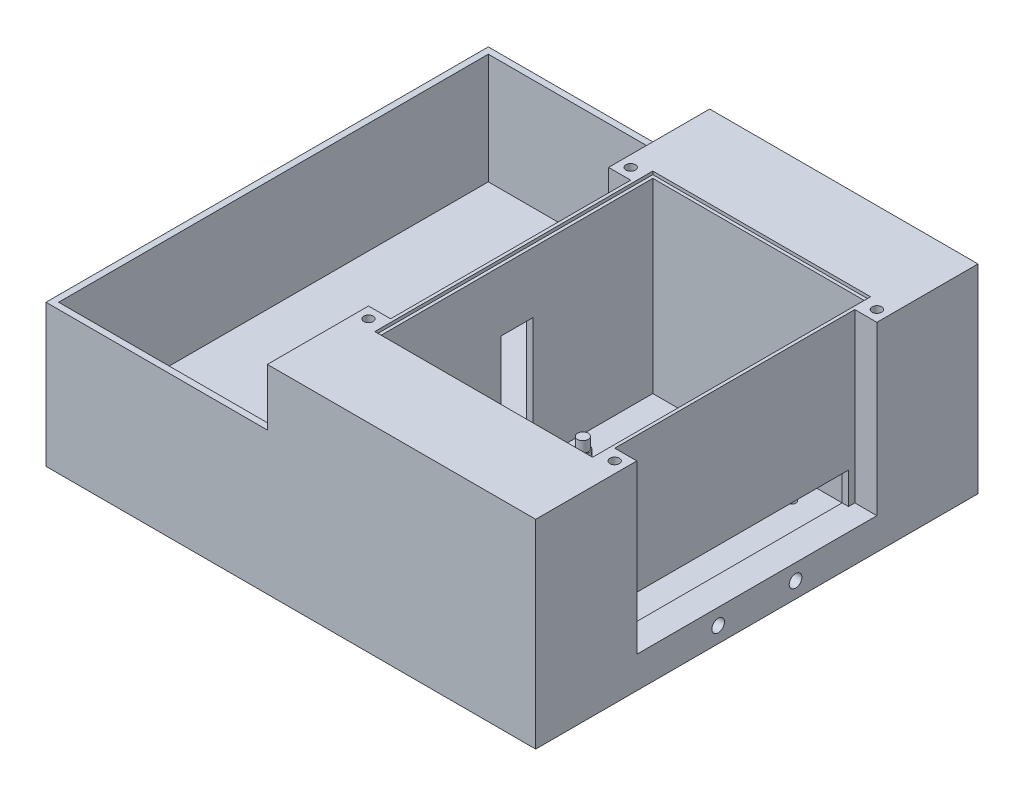
from build123d import *

# Parameters (mm, degrees)
SKETCH_1_W           = 155
SKETCH_1_H           = 90
EXTRUDE_2_DEPTH      = 10
CUT_EXTRUDE_1_DEPTH  = 7
SKETCH_3_R           = 2
EXTRUDE_3_DEPTH      = 2
SKETCH_4_R           = 1.7
EXTRUDE_4_DEPTH      = 3.4
EXTRUDE_5_DEPTH      = 14
SKETCH_6_W           = 7
SKETCH_6_H           = 7
EXTRUDE_6_DEPTH      = 14
SKETCH_16_W          = 68.929560361
SKETCH_16_H          = 88
CUT_EXTRUDE_3_DEPTH  = 1
SKETCH_17_R          = 1.5
CUT_EXTRUDE_4_DEPTH  = 5
SKETCH_18_R          = 2
CUT_EXTRUDE_5_DEPTH  = 18
CUT_EXTRUDE_START    = -17
SKETCH_20_R          = 2
CUT_EXTRUDE_8_DEPTH  = 17
SKETCH_21_W          = 7
SKETCH_21_H          = 7
SKETCH_21_R          = 1
EXTRUDE_7_DEPTH      = 90
SKETCH_22_W          = 86.23703967
SKETCH_22_H          = 80
CUT_EXTRUDE_11_DEPTH = 7
SKETCH_23_R          = 1
CUT_EXTRUDE_12_DEPTH = 90
SKETCH_25_W          = 2
SKETCH_25_H          = 7
EXTRUDE_8_DEPTH      = 10
SKETCH_26_W          = 72
SKETCH_26_H          = 10
CUT_EXTRUDE_13_DEPTH = 16
SKETCH_27_R          = 1
CUT_EXTRUDE_14_DEPTH = 7
CUT_EXTRUDE_START_2  = -7
SKETCH_28_R          = 1
CUT_EXTRUDE_15_DEPTH = 7
SKETCH_30_W          = 7
SKETCH_30_H          = 5
CUT_EXTRUDE_16_DEPTH = 7
SKETCH_32_W          = 90
SKETCH_32_H          = 10
CUT_EXTRUDE_17_DEPTH = 8
SKETCH_36_W          = 90
SKETCH_36_H          = 10
SKETCH_36_R          = 2
EXTRUDE_9_DEPTH      = 8
SKETCH_37_R          = 1
EXTRUDE_10_DEPTH     = 2
EXTRUDE_START        = -2
SKETCH_39_R          = 1
EXTRUDE_11_DEPTH     = 2
EXTRUDE_12_DEPTH     = 25
EXTRUDE_13_DEPTH     = 25
EXTRUDE_14_DEPTH     = 35
SKETCH_47_W          = 10
SKETCH_47_H          = 10.796424299
CUT_EXTRUDE_18_DEPTH = 4
EXTRUDE_START_2      = 39
SKETCH_51_R          = 1.5
SKETCH_51_W          = 68.929560361
SKETCH_51_H          = 88
EXTRUDE_15_DEPTH     = 39
SKETCH_52_W          = 68.929560361
SKETCH_52_H          = 88
SKETCH_52_W_2        = 66.929560361
SKETCH_52_H_2        = 86
EXTRUDE_16_DEPTH     = 39
SKETCH_56_W          = 10
SKETCH_56_H          = 22
CUT_EXTRUDE_19_DEPTH = 39
SKETCH_57_R          = 1.4
CUT_EXTRUDE_21_DEPTH = 39
SKETCH_58_R          = 1.4
EXTRUDE_17_DEPTH     = 5
SKETCH_59_W          = 7
SKETCH_59_H          = 76
CUT_EXTRUDE_22_DEPTH = 2


with BuildPart() as part:
    # Эскиз1 → Бобышка-Вытянуть2 (new body)
    with BuildSketch(Plane(origin=(0, 0, 0), x_dir=(1, 0, 0), z_dir=(0, 1, 0))):
        with Locations((-1.156716418, -16.830553117)):
            Rectangle(SKETCH_1_W, SKETCH_1_H)
    extrude(amount=EXTRUDE_2_DEPTH)

    # Эскиз2 → Вырез-Вытянуть1 (cut)
    with BuildSketch(Plane(origin=(0, 10, 0), x_dir=(1, 0, 0), z_dir=(0, 1, 0))):
        Polygon((57.343283582, 26.169446883), (57.343283582, 28.169446883), (49.343283582, 28.169446883), (49.343283582, 26.169446883), (-7.586276779, 26.169446883), (-7.586276779, -59.830553117), (49.343283582, -59.830553117), (49.343283582, -61.830553117), (57.343283582, -61.830553117), (57.343283582, -59.830553117), (59.343283582, -59.830553117), (59.343283582, 26.169446883), align=None)
    extrude(amount=-CUT_EXTRUDE_1_DEPTH, mode=Mode.SUBTRACT)

    # Эскиз3 → Бобышка-Вытянуть3 (add)
    with BuildSketch(Plane(origin=(0, 3, 0), x_dir=(1, 0, 0), z_dir=(0, 1, 0))):
        with Locations((-1.54062003, -2.021576512)):
            Circle(SKETCH_3_R)
        with Locations((-1.54062003, -22.021576512)):
            Circle(SKETCH_3_R)
        with Locations((26.45937997, -2.021576512)):
            Circle(SKETCH_3_R)
        with Locations((26.45937997, -22.021576512)):
            Circle(SKETCH_3_R)
    extrude(amount=EXTRUDE_3_DEPTH)

    # Эскиз4 → Бобышка-Вытянуть4 (add)
    with BuildSketch(Plane(origin=(0, 5, 0), x_dir=(1, 0, 0), z_dir=(0, 1, 0))):
        with Locations((-1.54062003, -2.021576512)):
            Circle(SKETCH_4_R)
        with Locations((-1.54062003, -22.021576512)):
            Circle(SKETCH_4_R)
        with Locations((26.45937997, -22.021576512)):
            Circle(SKETCH_4_R)
        with Locations((26.45937997, -2.021576512)):
            Circle(SKETCH_4_R)
    extrude(amount=EXTRUDE_4_DEPTH)

    # Эскиз5 → Бобышка-Вытянуть5 (add)
    with BuildSketch(Plane(origin=(0, 10, 0), x_dir=(1, 0, 0), z_dir=(0, 1, 0))):
        Polygon((-9.586276779, 28.169446883), (61.343283582, 28.169446883), (61.343283582, 26.169446883), (61.343283582, -61.830553117), (-9.586276779, -61.830553117), (-9.586276779, 26.169446883), align=None)
        Polygon((49.343283582, -59.830553117), (57.343283582, -59.830553117), (59.343283582, -59.830553117), (59.343283582, 26.169446883), (-7.586276779, 26.169446883), (-7.586276779, -59.830553117), align=None, mode=Mode.SUBTRACT)
    extrude(amount=EXTRUDE_5_DEPTH)

    # Эскиз6 → Бобышка-Вытянуть6 (add)
    with BuildSketch(Plane(origin=(0, 10, 0), x_dir=(1, 0, 0), z_dir=(0, 1, 0))):
        with Locations((64.843283582, 24.669446883)):
            Rectangle(SKETCH_6_W, SKETCH_6_H)
        with Locations((64.843283582, -58.330553117)):
            Rectangle(SKETCH_6_W, SKETCH_6_H)
        with Locations((-13.086276779, -58.330553117)):
            Rectangle(SKETCH_6_W, SKETCH_6_H)
        with Locations((-13.086276779, 24.669446883)):
            Rectangle(SKETCH_6_W, SKETCH_6_H)
    extrude(amount=EXTRUDE_6_DEPTH)

    # Эскиз16 → Вырез-Вытянуть3 (cut)
    with BuildSketch(Plane(origin=(0, 24, 0), x_dir=(1, 0, 0), z_dir=(0, 1, 0))):
        with Locations((25.878503402, -16.830553117)):
            Rectangle(SKETCH_16_W, SKETCH_16_H)
    extrude(amount=-CUT_EXTRUDE_3_DEPTH, mode=Mode.SUBTRACT)

    # Эскиз17 → Вырез-Вытянуть4 (cut)
    with BuildSketch(Plane(origin=(0, 24, 0), x_dir=(1, 0, 0), z_dir=(0, 1, 0))):
        with Locations((-13.086276779, 24.669446883)):
            Circle(SKETCH_17_R)
        with Locations((64.843283582, 24.669446883)):
            Circle(SKETCH_17_R)
        with Locations((-13.086276779, -58.330553117)):
            Circle(SKETCH_17_R)
        with Locations((64.843283582, -58.330553117)):
            Circle(SKETCH_17_R)
    extrude(amount=-CUT_EXTRUDE_4_DEPTH, mode=Mode.SUBTRACT)

    # Эскиз18 → Вырез-Вытянуть5 (cut)
    with BuildSketch(Plane(origin=(76.343283582, 0, 0), x_dir=(0, 0, -1), z_dir=(1, 0, 0))):
        with Locations((-29.080553117, 5)):
            Circle(SKETCH_18_R)
        with Locations((-4.580553117, 5)):
            Circle(SKETCH_18_R)
    extrude(amount=-CUT_EXTRUDE_5_DEPTH, mode=Mode.SUBTRACT)

    # Эскиз20 → Вырез-Вытянуть8 (cut)
    with BuildSketch(Plane.ZY.offset(78.656716418).offset(CUT_EXTRUDE_START)):
        with Locations((4.580553117, 5)):
            Circle(SKETCH_20_R)
        with Locations((29.080553117, 5)):
            Circle(SKETCH_20_R)
    extrude(amount=CUT_EXTRUDE_8_DEPTH, mode=Mode.SUBTRACT)

    # Эскиз21 → Бобышка-Вытянуть7 (add)
    # profile 1 of 2: a face of its own
    with BuildSketch(Plane.XY.offset(61.830553117)):
        with Locations((72.843283582, -3.5)):
            Rectangle(SKETCH_21_W, SKETCH_21_H)
    # profile 2 of 2: a face of its own
    with BuildSketch(Plane.XY.offset(61.830553117)):
        with Locations((1.843283582, -3.5)):
            Rectangle(SKETCH_21_W, SKETCH_21_H)
        with Locations((1.843283582, -3.5)):
            Circle(SKETCH_21_R, mode=Mode.SUBTRACT)
    extrude(amount=-EXTRUDE_7_DEPTH)

    # Эскиз22 → Вырез-Вытянуть11 (cut)
    with BuildSketch(Plane.XZ.offset(7)):
        with Locations((33.224763747, 16.830553117)):
            Rectangle(SKETCH_22_W, SKETCH_22_H)
    extrude(amount=-CUT_EXTRUDE_11_DEPTH, mode=Mode.SUBTRACT)

    # Эскиз23 → Вырез-Вытянуть12 (cut)
    with BuildSketch(Plane.XY.offset(61.830553117)):
        with Locations((72.843283582, -3.5)):
            Circle(SKETCH_23_R)
    extrude(amount=-CUT_EXTRUDE_12_DEPTH, mode=Mode.SUBTRACT)

    # Эскиз25 → Бобышка-Вытянуть8 (add)
    with BuildSketch(Plane(origin=(49.343283582, 0, 0), x_dir=(0, 0, -1), z_dir=(1, 0, 0))):
        with Locations((-60.830553117, 6.5)):
            Rectangle(SKETCH_25_W, SKETCH_25_H)
        with Locations((27.169446883, 6.5)):
            Rectangle(SKETCH_25_W, SKETCH_25_H)
    extrude(amount=EXTRUDE_8_DEPTH)

    # Эскиз26 → Вырез-Вытянуть13 (cut)
    with BuildSketch(Plane(origin=(61.343283582, 0, 0), x_dir=(0, 0, -1), z_dir=(1, 0, 0))):
        with Locations((-16.830553117, 15)):
            Rectangle(SKETCH_26_W, SKETCH_26_H)
    extrude(amount=-CUT_EXTRUDE_13_DEPTH, mode=Mode.SUBTRACT)

    # Эскиз27 → Вырез-Вытянуть14 (cut)
    with BuildSketch(Plane.XY.offset(61.830553117)):
        with Locations((1.843283582, 5)):
            Circle(SKETCH_27_R)
        with Locations((72.843283582, 5)):
            Circle(SKETCH_27_R)
    extrude(amount=-CUT_EXTRUDE_14_DEPTH, mode=Mode.SUBTRACT)

    # Эскиз28 → Вырез-Вытянуть15 (cut)
    with BuildSketch(Plane(origin=(0, 0, -28.169446883), x_dir=(-1, 0, 0), z_dir=(0, 0, -1)).offset(CUT_EXTRUDE_START_2)):
        with Locations((-72.843283582, 5)):
            Circle(SKETCH_28_R)
        with Locations((-1.843283582, 5)):
            Circle(SKETCH_28_R)
    extrude(amount=CUT_EXTRUDE_15_DEPTH, mode=Mode.SUBTRACT)

    # Эскиз30 → Вырез-Вытянуть16 (cut)
    with BuildSketch(Plane.XZ.offset(7)):
        with Locations((1.843283582, 59.330553117)):
            Rectangle(SKETCH_30_W, SKETCH_30_H)
        with Locations((72.843283582, 59.330553117)):
            Rectangle(SKETCH_30_W, SKETCH_30_H)
        with Locations((1.843283582, -25.669446883)):
            Rectangle(SKETCH_30_W, SKETCH_30_H)
        with Locations((72.843283582, -25.669446883)):
            Rectangle(SKETCH_30_W, SKETCH_30_H)
    extrude(amount=-CUT_EXTRUDE_16_DEPTH, mode=Mode.SUBTRACT)

    # Эскиз32 → Вырез-Вытянуть17 (cut)
    with BuildSketch(Plane(origin=(76.343283582, 0, 0), x_dir=(0, 0, -1), z_dir=(1, 0, 0))):
        with Locations((-16.830553117, 5)):
            Rectangle(SKETCH_32_W, SKETCH_32_H)
    extrude(amount=-CUT_EXTRUDE_17_DEPTH, mode=Mode.SUBTRACT)

    # Эскиз36 → Бобышка-Вытянуть9 (add)
    with BuildSketch(Plane.ZY.offset(78.656716418)):
        with Locations((16.830553117, 5)):
            Rectangle(SKETCH_36_W, SKETCH_36_H)
        with Locations((4.580553117, 5)):
            Circle(SKETCH_36_R, mode=Mode.SUBTRACT)
        with Locations((29.080553117, 5)):
            Circle(SKETCH_36_R, mode=Mode.SUBTRACT)
    extrude(amount=EXTRUDE_9_DEPTH)

    # Эскиз37 → Бобышка-Вытянуть10 (add)
    with BuildSketch(Plane.XY.offset(61.830553117)):
        with Locations((1.843283582, 5)):
            Circle(SKETCH_37_R)
    extrude(amount=-EXTRUDE_10_DEPTH)

    # Эскиз39 → Бобышка-Вытянуть11 (add)
    with BuildSketch(Plane(origin=(0, 0, -28.169446883), x_dir=(-1, 0, 0), z_dir=(0, 0, -1)).offset(EXTRUDE_START)):
        with Locations((-1.843283582, 5)):
            Circle(SKETCH_39_R)
    extrude(amount=EXTRUDE_11_DEPTH)

    # Эскиз42 → Бобышка-Вытянуть12 (add)
    with BuildSketch(Plane(origin=(0, 0, -28.169446883), x_dir=(-1, 0, 0), z_dir=(0, 0, -1))):
        Polygon((-68.343283582, 24), (-68.343283582, 0), (86.656716418, 0), (86.656716418, 10), (16.586276779, 10), (16.586276779, 24), align=None)
    extrude(amount=EXTRUDE_12_DEPTH)

    # Эскиз43 → Бобышка-Вытянуть13 (add)
    with BuildSketch(Plane.XY.offset(61.830553117)):
        Polygon((-86.656716418, 10), (-86.656716418, 0), (68.343283582, 0), (68.343283582, 24), (-16.586276779, 24), (-16.586276779, 10), align=None)
    extrude(amount=EXTRUDE_13_DEPTH)

    # Эскиз46 → Бобышка-Вытянуть14 (add)
    with BuildSketch(Plane(origin=(0, 10, 0), x_dir=(1, 0, 0), z_dir=(0, 1, 0))):
        Polygon((-16.586276779, 51.169446883), (-16.586276779, 53.169446883), (-86.656716418, 53.169446883), (-86.656716418, -86.830553117), (-16.586276779, -86.830553117), (-16.586276779, -84.830553117), (-84.656716418, -84.830553117), (-84.656716418, 51.169446883), align=None)
    extrude(amount=EXTRUDE_14_DEPTH)

    # Эскиз47 → Вырез-Вытянуть18 (cut)
    with BuildSketch(Plane.ZY.offset(9.586276779)):
        with Locations((16.830553117, 15.39821215)):
            Rectangle(SKETCH_47_W, SKETCH_47_H)
    extrude(amount=-CUT_EXTRUDE_18_DEPTH, mode=Mode.SUBTRACT)

    # Эскиз51 → Бобышка-Вытянуть15 (add)
    with BuildSketch(Plane(origin=(0, 24, 0), x_dir=(1, 0, 0), z_dir=(0, 1, 0)).offset(EXTRUDE_START_2)):
        Polygon((-16.586276779, 53.169446883), (-16.586276779, 21.169446883), (-9.586276779, 21.169446883), (-9.586276779, -54.830553117), (-16.586276779, -54.830553117), (-16.586276779, -86.830553117), (68.343283582, -86.830553117), (68.343283582, -54.830553117), (61.343283582, -54.830553117), (61.343283582, 21.169446883), (68.343283582, 21.169446883), (68.343283582, 53.169446883), align=None)
        with Locations((-13.086276779, -58.330553117)):
            Circle(SKETCH_51_R, mode=Mode.SUBTRACT)
        with Locations((64.843283582, -58.330553117)):
            Circle(SKETCH_51_R, mode=Mode.SUBTRACT)
        with Locations((64.843283582, 24.669446883)):
            Circle(SKETCH_51_R, mode=Mode.SUBTRACT)
        with Locations((-13.086276779, 24.669446883)):
            Circle(SKETCH_51_R, mode=Mode.SUBTRACT)
        with Locations((25.878503402, -16.830553117)):
            Rectangle(SKETCH_51_W, SKETCH_51_H, mode=Mode.SUBTRACT)
    extrude(amount=-EXTRUDE_15_DEPTH)

    # Эскиз52 → Бобышка-Вытянуть16 (add)
    with BuildSketch(Plane(origin=(0, 23, 0), x_dir=(1, 0, 0), z_dir=(0, 1, 0))):
        with Locations((25.878503402, -16.830553117)):
            Rectangle(SKETCH_52_W, SKETCH_52_H)
        with Locations((25.878503402, -16.830553117)):
            Rectangle(SKETCH_52_W_2, SKETCH_52_H_2, mode=Mode.SUBTRACT)
    extrude(amount=EXTRUDE_16_DEPTH)

    # Эскиз56 → Вырез-Вытянуть19 (cut)
    with BuildSketch(Plane.ZY.offset(9.586276779)):
        with Locations((16.830553117, 31.796424299)):
            Rectangle(SKETCH_56_W, SKETCH_56_H)
    extrude(amount=-CUT_EXTRUDE_19_DEPTH, mode=Mode.SUBTRACT)

    # Эскиз57 → Вырез-Вытянуть21 (cut)
    with BuildSketch(Plane(origin=(0, 3, 0), x_dir=(1, 0, 0), z_dir=(0, 1, 0))):
        with Locations((43.686710337, 18.769446883)):
            Circle(SKETCH_57_R)
        with Locations((54.886710337, 18.769446883)):
            Circle(SKETCH_57_R)
        with Locations((43.686710337, -52.430553117)):
            Circle(SKETCH_57_R)
        with Locations((54.886710337, -52.430553117)):
            Circle(SKETCH_57_R)
    extrude(amount=-CUT_EXTRUDE_21_DEPTH, mode=Mode.SUBTRACT)

    # Эскиз58 → Бобышка-Вытянуть17 (add)
    # profile 1 of 2: a face of its own
    with BuildSketch(Plane(origin=(0, 45, 0), x_dir=(1, 0, 0), z_dir=(0, 1, 0))):
        Polygon((-9.586276779, 21.169446883), (-16.586276779, 21.169446883), (-9.586276779, 14.169446883), align=None)
        with Locations((-11.336276779, 19.419446883)):
            Circle(SKETCH_58_R, mode=Mode.SUBTRACT)
    # profile 2 of 2: a face of its own
    with BuildSketch(Plane(origin=(0, 45, 0), x_dir=(1, 0, 0), z_dir=(0, 1, 0))):
        Polygon((-16.586276779, -54.830553117), (-9.586276779, -54.830553117), (-9.586276779, -47.830553117), align=None)
        with Locations((-11.336276779, -53.080553117)):
            Circle(SKETCH_58_R, mode=Mode.SUBTRACT)
    extrude(amount=-EXTRUDE_17_DEPTH)

    # Эскиз59 → Вырез-Вытянуть22 (cut)
    with BuildSketch(Plane(origin=(0, 45, 0), x_dir=(1, 0, 0), z_dir=(0, 1, 0))):
        with Locations((-13.086276779, -16.830553117)):
            Rectangle(SKETCH_59_W, SKETCH_59_H)
    extrude(amount=-CUT_EXTRUDE_22_DEPTH, mode=Mode.SUBTRACT)


solid = part.part
